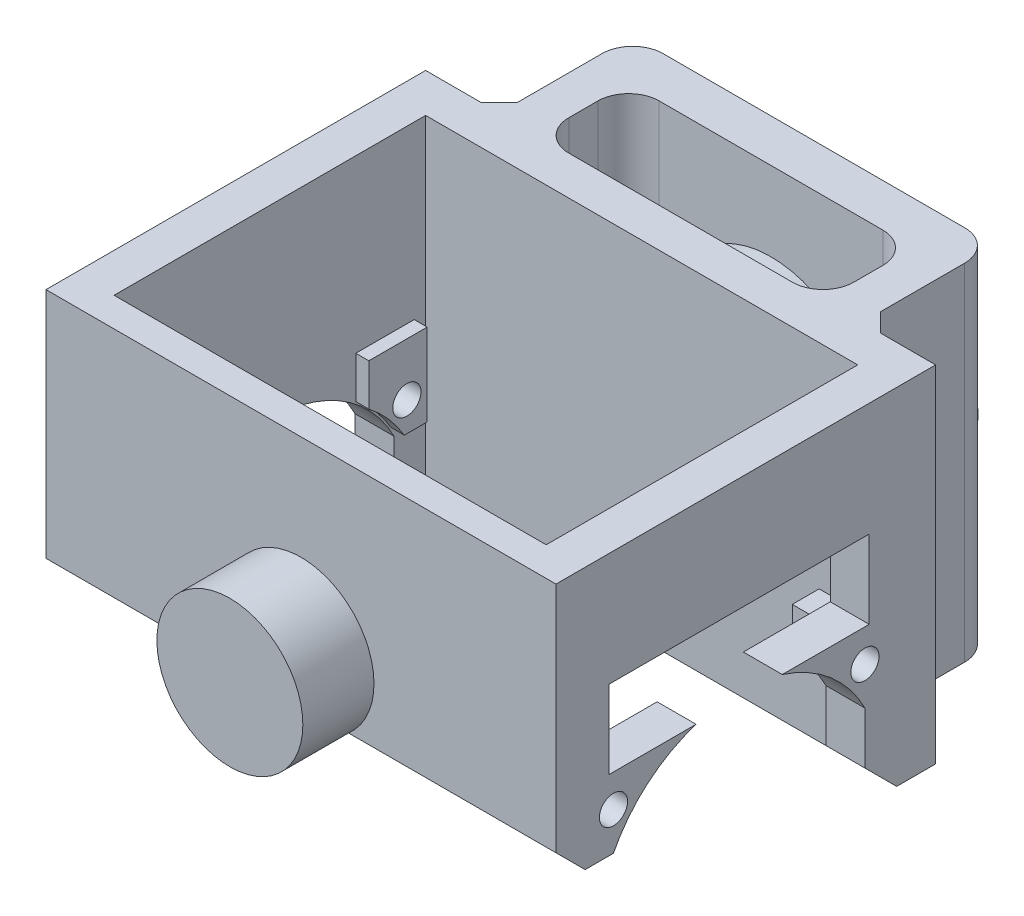
from build123d import *
from build123d.topology import SkipClean

# Parameters (mm, degrees)
SKETCH1_W                       = 25
SKETCH1_H                       = 30
BOSS_EXTRUDE1_DEPTH             = 3.175
SKETCH2_W                       = 25
SKETCH2_H                       = 3.175
BOSS_EXTRUDE2_DEPTH             = 41.58
SKETCH3_W                       = 3.175
SKETCH3_H                       = 25
BOSS_EXTRUDE3_DEPTH             = 30
CUT_EXTRUDE1_REACH              = 60.775
SKETCH4_R                       = 11.5
CUT_EXTRUDE2_REACH              = 60.775
SKETCH5_R                       = 0.8
SKETCH5_R_2                     = 1.15
CUT_EXTRUDE3_REACH              = 60.775
SKETCH6_R                       = 0.799851166
SKETCH6_R_2                     = 0.8
SKETCH6_R_3                     = 1.15
SKETCH6_W                       = 21.2
SKETCH6_H                       = 6.375
CUT_EXTRUDE4_REACH              = 60.775
SKETCH7_R                       = 11.5
BOSS_EXTRUDE4_DEPTH             = 0.2
SKETCH9_W                       = 41.58
SKETCH9_H                       = 33.175
BOSS_EXTRUDE5_DEPTH             = 3.175
BOSS_EXTRUDE6_DEPTH             = 0.2
SKETCH11_W                      = 41.58
SKETCH11_H                      = 33.175
BOSS_EXTRUDE7_DEPTH             = 3.175
CHAMFER1_SIZE                   = 3.175
CHAMFER2_SIZE                   = 3.175
SKETCH13_W                      = 29.58
SKETCH13_H                      = 3.175
BOSS_EXTRUDE8_DEPTH             = 7.695
BOSS_EXTRUDE9_REACH             = 59.968
SKETCH14_W                      = 29.58
SKETCH14_H                      = 3.5
BOSS_EXTRUDE9_DIRECTION_2_DEPTH = 25
FILLET2_R                       = 1.5875
CUT_EXTRUDE5_REACH              = 70.161
SKETCH16_R                      = 7.1
SKETCH20_R                      = 8
SKETCH20_R_2                    = 4.1
BOSS_EXTRUDE11_DEPTH            = 5
BOSS_EXTRUDE12_DEPTH            = 5
BOSS_EXTRUDE12_DEPTH_BACK       = 1.2
SKETCH23_R                      = 5.95
SKETCH23_R_2                    = 4.1
CUT_EXTRUDE9_START              = -0.8
SKETCH35_W                      = 56.674577384
SKETCH35_H                      = 32.233153273
SKETCH35_R                      = 5.95
CUT_EXTRUDE9_DEPTH              = 0.8
CHAMFER4_SIZE                   = 1.5
SKETCH24_R                      = 11.575
SKETCH24_R_2                    = 10.075
BOSS_EXTRUDE13_DEPTH            = 1.8
SKETCH25_W                      = 108.105246784
SKETCH25_H                      = 63.591321638
CUT_EXTRUDE7_DEPTH              = 11.825
CUT_EXTRUDE8_START              = -3.175
SKETCH26_R                      = 4.1
CUT_EXTRUDE8_DEPTH              = 3.175
BOSS_EXTRUDE14_START            = 1.975
BOSS_EXTRUDE14_DEPTH            = 1.975
BOSS_EXTRUDE16_START            = 3.5
SKETCH29_R                      = 7.1
SKETCH29_R_2                    = 4.1
BOSS_EXTRUDE16_DEPTH            = 3.5
BOSS_EXTRUDE17_REACH            = 66.275
SKETCH31_W                      = 3.175
SKETCH31_H                      = 26.839044126
BOSS_EXTRUDE18_DEPTH            = 6.825
SKETCH34_R                      = 8
SKETCH34_R_2                    = 4.1
BOSS_EXTRUDE19_DEPTH            = 2.37
CUT_EXTRUDE6_REACH              = 66.865
SKETCH21_R                      = 1.9
CHAMFER7_SIZE                   = 3.175
SKETCH36_R                      = 7.5
CUT_EXTRUDE10_DEPTH             = 0.4
BOSS_EXTRUDE20_START            = -8.175
SKETCH37_R                      = 4.1
BOSS_EXTRUDE20_DEPTH            = 8.175
SKETCH39_R                      = 1.15
BOSS_EXTRUDE22_DEPTH            = 1.87
BOSS_EXTRUDE23_DEPTH            = 1.06
CUT_EXTRUDE11_START             = -3.175
CUT_EXTRUDE11_OUTLINE_W         = 23.23
CUT_EXTRUDE11_OUTLINE_H         = 7.37
CUT_EXTRUDE11_DEPTH             = 4.675
FILLET3_R                       = 2.5
FILLET4_R                       = 2.5
SKETCH42_W                      = 3.501413345
SKETCH42_H                      = 2.461352655
SKETCH42_W_2                    = 5.24981121
SKETCH42_H_2                    = 2.530526346
CUT_EXTRUDE12_DEPTH             = 63.204589294
CUT_EXTRUDE13_DEPTH             = 61.128683291
CUT_EXTRUDE13_DEPTH_BACK        = 61.128683291
SKETCH44_R                      = 1.15
CUT_EXTRUDE14_DEPTH             = 10


# Read off the part's stored shape, not the designer's step: Cut-Extrude11
# Some blends are built 0.0001 mm under size
with BuildPart() as part:
    # Sketch1 → Boss-Extrude1 (new body)
    with BuildSketch(Plane(origin=(0, 0, 0), x_dir=(0, 0, -1), z_dir=(1, 0, 0))):
        with Locations((12.5, 15)):
            Rectangle(SKETCH1_W, SKETCH1_H)
    extrude(amount=BOSS_EXTRUDE1_DEPTH)

    # Sketch2 → Boss-Extrude2 (add)
    with BuildSketch(Plane.ZY):
        with Locations((-12.5, 31.5875)):
            Rectangle(SKETCH2_W, SKETCH2_H)
    extrude(amount=-BOSS_EXTRUDE2_DEPTH)

    # Sketch3 → Boss-Extrude3 (add)
    with BuildSketch(Plane.XZ.offset(-30)):
        with Locations((39.9925, -12.5)):
            Rectangle(SKETCH3_W, SKETCH3_H)
    extrude(amount=BOSS_EXTRUDE3_DEPTH)

    # Sketch4 → Cut-Extrude1 (cut, up to next)
    with BuildSketch(Plane.ZY, mode=Mode.PRIVATE) as cut_extrude1_sk1:
        with Locations((-12.359999929, -5.209996254)):
            Circle(SKETCH4_R)
    cut_extrude1_tool1 = extrude(cut_extrude1_sk1.sketch, amount=-CUT_EXTRUDE1_REACH, mode=Mode.PRIVATE) & part.part
    add(cut_extrude1_tool1.solids().sort_by_distance((0, -5.209996, -12.36))[0], mode=Mode.SUBTRACT)

    # Sketch5 → Cut-Extrude2 (cut, up to next)
    with BuildSketch(Plane.ZY, mode=Mode.PRIVATE) as cut_extrude2_sk1:
        with Locations((-22.609999929, 23.790003746)):
            Circle(SKETCH5_R)
    cut_extrude2_tool1 = extrude(cut_extrude2_sk1.sketch, amount=-CUT_EXTRUDE2_REACH, mode=Mode.PRIVATE) & part.part
    # Sketch5 → Cut-Extrude2 (cut, up to next)
    with BuildSketch(Plane.ZY, mode=Mode.PRIVATE) as cut_extrude2_sk2:
        with Locations((-2.109999929, 23.790003746)):
            Circle(SKETCH5_R)
    cut_extrude2_tool2 = extrude(cut_extrude2_sk2.sketch, amount=-CUT_EXTRUDE2_REACH, mode=Mode.PRIVATE) & part.part
    # Sketch5 → Cut-Extrude2 (cut, up to next)
    with BuildSketch(Plane.ZY, mode=Mode.PRIVATE) as cut_extrude2_sk3:
        with Locations((-22.609999929, 3.090003746)):
            Circle(SKETCH5_R_2)
    cut_extrude2_tool3 = extrude(cut_extrude2_sk3.sketch, amount=-CUT_EXTRUDE2_REACH, mode=Mode.PRIVATE) & part.part
    # Sketch5 → Cut-Extrude2 (cut, up to next)
    with BuildSketch(Plane.ZY, mode=Mode.PRIVATE) as cut_extrude2_sk4:
        with Locations((-2.109999929, 3.090003746)):
            Circle(SKETCH5_R_2)
    cut_extrude2_tool4 = extrude(cut_extrude2_sk4.sketch, amount=-CUT_EXTRUDE2_REACH, mode=Mode.PRIVATE) & part.part
    add(cut_extrude2_tool1.solids().sort_by_distance((0, 23.790004, -22.61))[0], mode=Mode.SUBTRACT)
    add(cut_extrude2_tool2.solids().sort_by_distance((0, 23.790004, -2.11))[0], mode=Mode.SUBTRACT)
    add(cut_extrude2_tool3.solids().sort_by_distance((0, 3.090004, -22.61))[0], mode=Mode.SUBTRACT)
    add(cut_extrude2_tool4.solids().sort_by_distance((0, 3.090004, -2.11))[0], mode=Mode.SUBTRACT)

    # Sketch6 → Cut-Extrude3 (cut, up to next)
    with BuildSketch(Plane(origin=(41.58, 0, 0), x_dir=(0, 0, -1), z_dir=(1, 0, 0)), mode=Mode.PRIVATE) as cut_extrude3_sk1:
        with Locations((22.609999929, 27.540003746)):
            Circle(SKETCH6_R)
    cut_extrude3_tool1 = extrude(cut_extrude3_sk1.sketch, amount=-CUT_EXTRUDE3_REACH, mode=Mode.PRIVATE) & part.part
    # Sketch6 → Cut-Extrude3 (cut, up to next)
    with BuildSketch(Plane(origin=(41.58, 0, 0), x_dir=(0, 0, -1), z_dir=(1, 0, 0)), mode=Mode.PRIVATE) as cut_extrude3_sk2:
        with Locations((2.109999929, 27.540003746)):
            Circle(SKETCH6_R_2)
    cut_extrude3_tool2 = extrude(cut_extrude3_sk2.sketch, amount=-CUT_EXTRUDE3_REACH, mode=Mode.PRIVATE) & part.part
    # Sketch6 → Cut-Extrude3 (cut, up to next)
    with BuildSketch(Plane(origin=(41.58, 0, 0), x_dir=(0, 0, -1), z_dir=(1, 0, 0)), mode=Mode.PRIVATE) as cut_extrude3_sk3:
        with Locations(Location((2.109999929, 3.090003746, 0), (0, 0, 180))):
            Circle(SKETCH6_R_3)
    cut_extrude3_tool3 = extrude(cut_extrude3_sk3.sketch, amount=-CUT_EXTRUDE3_REACH, mode=Mode.PRIVATE) & part.part
    # Sketch6 → Cut-Extrude3 (cut, up to next)
    with BuildSketch(Plane(origin=(41.58, 0, 0), x_dir=(0, 0, -1), z_dir=(1, 0, 0)), mode=Mode.PRIVATE) as cut_extrude3_sk4:
        with Locations(Location((22.609999929, 3.090003746, 0), (0, 0, 180))):
            Circle(SKETCH6_R_3)
    cut_extrude3_tool4 = extrude(cut_extrude3_sk4.sketch, amount=-CUT_EXTRUDE3_REACH, mode=Mode.PRIVATE) & part.part
    # Sketch6 → Cut-Extrude3 (cut, up to next)
    with BuildSketch(Plane(origin=(41.58, 0, 0), x_dir=(0, 0, -1), z_dir=(1, 0, 0)), mode=Mode.PRIVATE) as cut_extrude3_sk5:
        with Locations((12.359999929, 8.927503746)):
            Rectangle(SKETCH6_W, SKETCH6_H)
    cut_extrude3_tool5 = extrude(cut_extrude3_sk5.sketch, amount=-CUT_EXTRUDE3_REACH, mode=Mode.PRIVATE) & part.part
    add(cut_extrude3_tool1.solids().sort_by_distance((41.58, 27.540004, -22.61))[0], mode=Mode.SUBTRACT)
    add(cut_extrude3_tool2.solids().sort_by_distance((41.58, 27.540004, -2.11))[0], mode=Mode.SUBTRACT)
    add(cut_extrude3_tool3.solids().sort_by_distance((41.58, 3.090004, -2.11))[0], mode=Mode.SUBTRACT)
    add(cut_extrude3_tool4.solids().sort_by_distance((41.58, 3.090004, -22.61))[0], mode=Mode.SUBTRACT)
    add(cut_extrude3_tool5.solids().sort_by_distance((41.58, 8.927504, -12.36))[0], mode=Mode.SUBTRACT)

    # Sketch7 → Cut-Extrude4 (cut, up to next)
    with BuildSketch(Plane(origin=(41.58, 0, 0), x_dir=(0, 0, -1), z_dir=(1, 0, 0)), mode=Mode.PRIVATE) as cut_extrude4_sk1:
        with Locations((12.359999929, -5.209996254)):
            Circle(SKETCH7_R)
    cut_extrude4_tool1 = extrude(cut_extrude4_sk1.sketch, amount=-CUT_EXTRUDE4_REACH, mode=Mode.PRIVATE) & part.part
    add(cut_extrude4_tool1.solids().sort_by_distance((41.58, -5.209996, -12.36))[0], mode=Mode.SUBTRACT)

    # Sketch8 → Boss-Extrude4 (add)
    with BuildSketch(Plane.XY):
        Polygon((0, 33.175), (0, 0), (3.175, 0), (3.175, 30), (38.405, 30), (38.405, 0), (41.58, 0), (41.58, 33.175), align=None)
    extrude(amount=BOSS_EXTRUDE4_DEPTH)

    # Sketch9 → Boss-Extrude5 (add)
    with BuildSketch(Plane.XY.offset(0.2)):
        with Locations((20.79, 16.5875)):
            Rectangle(SKETCH9_W, SKETCH9_H)
    extrude(amount=BOSS_EXTRUDE5_DEPTH)

    # Sketch10 → Boss-Extrude6 (add)
    with BuildSketch(Plane(origin=(0, 0, -25), x_dir=(-1, 0, 0), z_dir=(0, 0, -1))):
        Polygon((0, 0), (0, 33.175), (-41.58, 33.175), (-41.58, 0), (-38.405, 0), (-38.405, 30), (-3.175, 30), (-3.175, 0), align=None)
    extrude(amount=BOSS_EXTRUDE6_DEPTH)

    # Sketch11 → Boss-Extrude7 (add)
    with BuildSketch(Plane(origin=(0, 0, -25.2), x_dir=(-1, 0, 0), z_dir=(0, 0, -1))):
        with Locations((-20.79, 16.5875)):
            Rectangle(SKETCH11_W, SKETCH11_H)
    extrude(amount=BOSS_EXTRUDE7_DEPTH)

    # Chamfer1
    chamfer1_edges = [part.edges().sort_by_distance(p)[0] for p in [
        (20.79, 33.175, 3.375),
        (20.79, 33.175, -28.375),
    ]]
    chamfer(chamfer1_edges, length=CHAMFER1_SIZE)

    # Chamfer2
    chamfer2_edges = [part.edges().sort_by_distance(p)[0] for p in [
        (20.79, 0, 3.375),
    ]]
    chamfer(chamfer2_edges, length=CHAMFER2_SIZE - 0.0001)  # a hair under: the kernel refuses the full size

    # Sketch13 → Boss-Extrude8 (add)
    with BuildSketch(Plane(origin=(0, 0, -28.375), x_dir=(-1, 0, 0), z_dir=(0, 0, -1))):
        with Locations((-20.79, 19.7625)):
            Rectangle(SKETCH13_W, SKETCH13_H)
    extrude(amount=BOSS_EXTRUDE8_DEPTH)

    # Boss-Extrude9: up to this face of the body (flat: up to its plane)
    boss_extrude9_end = Plane(part.part.faces().sort_by_distance((20.79, 21.35, -32.2225))[0])
    # Sketch14 → Boss-Extrude9 (add, up to the picked face)
    with BuildSketch(Plane.XZ.offset(-18.175), mode=Mode.PRIVATE) as boss_extrude9_sk1:
        with Locations((20.79, -37.495)):
            Rectangle(SKETCH14_W, SKETCH14_H)
    boss_extrude9_tool1 = split(extrude(boss_extrude9_sk1.sketch, amount=-BOSS_EXTRUDE9_REACH, mode=Mode.PRIVATE), bisect_by=boss_extrude9_end, keep=Keep.BOTH, mode=Mode.PRIVATE)
    add(boss_extrude9_tool1.solids().sort_by(Axis((20.79, 18.175, -37.495), (0, 1, 0)))[0])

    # Sketch14 → Boss-Extrude9 direction 2 (add)
    with BuildSketch(Plane.XZ.offset(-18.175)):
        with Locations((20.79, -37.495)):
            Rectangle(SKETCH14_W, SKETCH14_H)
    extrude(amount=BOSS_EXTRUDE9_DIRECTION_2_DEPTH)

    # Fillet2
    fillet2_edges = [part.edges().sort_by_distance(p)[0] for p in [
        (20.79, 21.35, -28.375),
    ]]
    fillet(fillet2_edges, radius=FILLET2_R)

    # Sketch16 → Cut-Extrude5 (cut, up to next)
    with BuildSketch(Plane(origin=(0, 0, -39.245), x_dir=(-1, 0, 0), z_dir=(0, 0, -1)), mode=Mode.PRIVATE) as cut_extrude5_sk1:
        with Locations((-20.79, 6.9025)):
            Circle(SKETCH16_R)
    cut_extrude5_tool1 = extrude(cut_extrude5_sk1.sketch, amount=-CUT_EXTRUDE5_REACH, mode=Mode.PRIVATE) & part.part
    add(cut_extrude5_tool1.solids().sort_by_distance((20.79, 6.9025, -39.245))[0], mode=Mode.SUBTRACT)

    # Sketch20 → Boss-Extrude11 (add)
    with BuildSketch(Plane.XY.offset(-35.745)):
        with Locations(Location((20.79, 6.9025, 0), (0, 0, 180))):
            Circle(SKETCH20_R)
        with Locations((20.79, 6.9025)):
            Circle(SKETCH20_R_2, mode=Mode.SUBTRACT)
    extrude(amount=BOSS_EXTRUDE11_DEPTH)

    # Sketch23 → Boss-Extrude12 (add, two sides: drawn at the far end of the back side and taken through both)
    with BuildSketch(Plane.XY.offset(3.375).offset(-BOSS_EXTRUDE12_DEPTH_BACK)):
        with Locations(Location((20.79, 6.9025, 0), (0, 0, 218.790206305))):
            Circle(SKETCH23_R)
        with Locations((20.79, 6.9025)):
            Circle(SKETCH23_R_2, mode=Mode.SUBTRACT)
    extrude(amount=BOSS_EXTRUDE12_DEPTH + BOSS_EXTRUDE12_DEPTH_BACK)

    # Sketch35 → Cut-Extrude9 (cut)
    with BuildSketch(Plane.XY.offset(3.375).offset(CUT_EXTRUDE9_START)):
        with Locations((23.209536951, 5.991217874)):
            Rectangle(SKETCH35_W, SKETCH35_H)
        with Locations(Location((20.79, 6.9025, 0), (0, 0, 229.545756186))):
            Circle(SKETCH35_R, mode=Mode.SUBTRACT)
    extrude(amount=CUT_EXTRUDE9_DEPTH, mode=Mode.SUBTRACT)

    # Chamfer4
    chamfer4_edges = [part.edges().sort_by_distance(p)[0] for p in [
        (35.58, 20.55625, -28.375),
        (20.79, 18.175, -28.375),
        (6, 20.55625, -28.375),
    ]]
    chamfer(chamfer4_edges, length=CHAMFER4_SIZE)

    # Sketch24 → Boss-Extrude13 (add)
    with BuildSketch(Plane(origin=(0, 0, -39.245), x_dir=(-1, 0, 0), z_dir=(0, 0, -1))):
        with Locations((-20.79, 6.9025)):
            Circle(SKETCH24_R)
        with Locations((-20.79, 6.9025)):
            Circle(SKETCH24_R_2, mode=Mode.SUBTRACT)
    extrude(amount=BOSS_EXTRUDE13_DEPTH)

    # Sketch25 → Cut-Extrude7 (cut)
    with BuildSketch(Plane(origin=(0, 33.175, 0), x_dir=(1, 0, 0), z_dir=(0, 1, 0))):
        with Locations((27.427563227, 10.078434484)):
            Rectangle(SKETCH25_W, SKETCH25_H)
    extrude(amount=-CUT_EXTRUDE7_DEPTH, mode=Mode.SUBTRACT)

    # Sketch26 → Cut-Extrude8 (cut)
    with BuildSketch(Plane.XY.offset(3.375).offset(CUT_EXTRUDE8_START)):
        with Locations((20.79, 6.9025)):
            Circle(SKETCH26_R)
    extrude(amount=CUT_EXTRUDE8_DEPTH, mode=Mode.SUBTRACT)

    # Sketch27 → Boss-Extrude14 (add)
    with SkipClean():  # the faces are left unmerged after this step: merging them gives an invalid solid
        with BuildSketch(Plane(origin=(0, 0, 2.175), x_dir=(-1, 0, 0), z_dir=(0, 0, -1)).offset(BOSS_EXTRUDE14_START)):
            with BuildLine():
                Line((-17.454997189, 1.975), (-24.125002811, 1.975))
                ThreePointArc((-24.125002811, 1.975), (-20.79, 0.9525), (-17.454997189, 1.975))
            make_face()
        extrude(amount=-BOSS_EXTRUDE14_DEPTH)

    # Sketch29 → Boss-Extrude16 (add)
    with SkipClean():  # the faces are left unmerged after this step: merging them gives an invalid solid
        with BuildSketch(Plane(origin=(0, 0, -35.745), x_dir=(-1, 0, 0), z_dir=(0, 0, -1)).offset(BOSS_EXTRUDE16_START)):
            with Locations((-20.79, 6.9025)):
                Circle(SKETCH29_R)
            with Locations(Location((-20.79, 6.9025, 0), (0, 0, 180))):
                Circle(SKETCH29_R_2, mode=Mode.SUBTRACT)
        extrude(amount=-BOSS_EXTRUDE16_DEPTH)

    # Boss-Extrude17: up to this face of the body (flat: up to its plane)
    boss_extrude17_end = Plane(part.part.faces().sort_by_distance((20.79, 8.948239046, -28.375))[0])
    # Sketch31 → Boss-Extrude17 (add, up to the picked face)
    with BuildSketch(Plane.XY.offset(-35.745), mode=Mode.PRIVATE) as boss_extrude17_sk1:
        with Locations((7.5875, 6.594522063)):
            Rectangle(SKETCH31_W, SKETCH31_H)
    boss_extrude17_tool1 = split(extrude(boss_extrude17_sk1.sketch, amount=BOSS_EXTRUDE17_REACH, mode=Mode.PRIVATE), bisect_by=boss_extrude17_end, keep=Keep.BOTH, mode=Mode.PRIVATE)
    # Sketch31 → Boss-Extrude17 (add, up to the picked face)
    with BuildSketch(Plane.XY.offset(-35.745), mode=Mode.PRIVATE) as boss_extrude17_sk2:
        with Locations((33.9925, 6.594522063)):
            Rectangle(SKETCH31_W, SKETCH31_H)
    boss_extrude17_tool2 = split(extrude(boss_extrude17_sk2.sketch, amount=BOSS_EXTRUDE17_REACH, mode=Mode.PRIVATE), bisect_by=boss_extrude17_end, keep=Keep.BOTH, mode=Mode.PRIVATE)
    add(boss_extrude17_tool1.solids().sort_by(Axis((7.5875, 6.594522, -35.745), (0, 0, 1)))[0])
    add(boss_extrude17_tool2.solids().sort_by(Axis((33.9925, 6.594522, -35.745), (0, 0, 1)))[0])

    # Sketch33 → Boss-Extrude18 (add)
    with SkipClean():  # the faces are left unmerged after this step: merging them gives an invalid solid
        with BuildSketch(Plane.XZ):
            Polygon((3.175, -25.2), (3.175, -22.612118687), (0, -22.612118687), (0, -28.375), (6, -28.375), (9.175, -28.375), (32.405, -28.375), (35.58, -28.375), (41.58, -28.375), (41.58, -22.612118687), (38.405, -22.612118687), (38.405, -25.2), align=None)
        extrude(amount=BOSS_EXTRUDE18_DEPTH)

    # Sketch34 → Boss-Extrude19 (add)
    with SkipClean():  # the faces are left unmerged after this step: merging them gives an invalid solid
        with BuildSketch(Plane.XY.offset(-30.745)):
            with Locations(Location((20.79, 6.9025, 0), (0, 0, 180))):
                Circle(SKETCH34_R)
            with Locations((20.79, 6.9025)):
                Circle(SKETCH34_R_2, mode=Mode.SUBTRACT)
        extrude(amount=BOSS_EXTRUDE19_DEPTH)

    # Cut-Extrude6: up to this face of the body (flat: up to its plane)
    cut_extrude6_end = Plane(part.part.faces().sort_by_distance((20.79, 18.175, -32.81))[0])
    # Sketch21 → Cut-Extrude6 (cut, up to the picked face)
    with BuildSketch(Plane.XZ.offset(6.825), mode=Mode.PRIVATE) as cut_extrude6_sk1:
        with Locations(Location((20.79, -32.06, 0), (0, 0, 270))):
            Circle(SKETCH21_R)
    cut_extrude6_tool1 = split(extrude(cut_extrude6_sk1.sketch, amount=-CUT_EXTRUDE6_REACH, mode=Mode.PRIVATE), bisect_by=cut_extrude6_end, keep=Keep.BOTH, mode=Mode.PRIVATE)
    add(cut_extrude6_tool1.solids().sort_by(Axis((20.79, -6.825, -32.06), (0, 1, 0)))[0], mode=Mode.SUBTRACT)

    # Chamfer7
    # the kernel refuses this chamfer: 3.175 mm, written as the material it takes off along each edge
    with BuildSketch(Plane(origin=(32.405, -6.825, -35.745), x_dir=(0, -0.02749587661058651, -0.9996219169112966), z_dir=(-1, 0, 0))) as chamfer7_piece_1:
        Polygon((CHAMFER7_SIZE * 0.999621916911, -CHAMFER7_SIZE * 0.0274958766106), (-CHAMFER7_SIZE * 0.0274958766106, -CHAMFER7_SIZE * 0.999621916911), (0, 0), align=None)
    extrude(amount=23.23, mode=Mode.SUBTRACT)
    with BuildSketch(Plane(origin=(32.405, -6.825, -28.375), x_dir=(0, -0.027495876610586455, 0.9996219169112968), z_dir=(-1, 0, 0))) as chamfer7_piece_2:
        Polygon((CHAMFER7_SIZE * 0.999621916911, CHAMFER7_SIZE * 0.0274958766106), (-CHAMFER7_SIZE * 0.0274958766106, CHAMFER7_SIZE * 0.999621916911), (0, 0), align=None)
    extrude(amount=23.23, mode=Mode.SUBTRACT)

    # Sketch36 → Cut-Extrude10 (cut)
    with BuildSketch(Plane(origin=(0, 0, -39.245), x_dir=(-1, 0, 0), z_dir=(0, 0, -1))):
        with Locations((-20.79, 6.9025)):
            Circle(SKETCH36_R)
    extrude(amount=-CUT_EXTRUDE10_DEPTH, mode=Mode.SUBTRACT)

    # Sketch37 → Boss-Extrude20 (add)
    with BuildSketch(Plane.XY.offset(8.375).offset(BOSS_EXTRUDE20_START)):
        with Locations(Location((20.79, 6.9025, 0), (0, 0, 180))):
            Circle(SKETCH37_R)
    extrude(amount=BOSS_EXTRUDE20_DEPTH)

    # Sketch39 → Boss-Extrude22 (add)
    # profile 1 of 2: a face of its own
    with BuildSketch(Plane.ZY.offset(-38.405)):
        with BuildLine():
            Line((-0.799999454, 5.240003755), (-1.259999929, 5.240003755))
            Line((-1.259999929, 5.240003755), (-5.060001007, 5.240003683))
            Line((-5.060001007, 5.240003683), (-5.060003358, 3.921799067))
            ThreePointArc((-5.060003358, 3.921799067), (-3.654457689, 2.593411337), (-2.487135002, 1.051487106))
            Line((-2.487135002, 1.051487106), (-1.000011391, 1.051488714))
            ThreePointArc((-1.000011391, 1.051488714), (-0.858544049, 1.11010249), (-0.80000455, 1.251600584))
            Line((-0.80000455, 1.251600584), (-0.799999454, 5.240003755))
        make_face()
        with Locations((-2.109999929, 3.090003746)):
            Circle(SKETCH39_R, mode=Mode.SUBTRACT)
    # profile 2 of 2: a face of its own
    with BuildSketch(Plane.ZY.offset(-38.405)):
        with BuildLine():
            Line((-23.459999929, 5.240003755), (-23.920005797, 5.240003755))
            Line((-23.920005797, 5.240003755), (-23.92000108, 1.251499539))
            ThreePointArc((-23.92000108, 1.251499539), (-23.861425337, 1.110068331), (-23.719996811, 1.051486113))
            Line((-23.719996811, 1.051486113), (-22.232868888, 1.051484514))
            ThreePointArc((-22.232868888, 1.051484514), (-21.065544591, 2.593411657), (-19.659996515, 3.921801637))
            Line((-19.659996515, 3.921801637), (-19.659998855, 5.240003683))
            Line((-19.659998855, 5.240003683), (-23.459999929, 5.240003755))
        make_face()
        with Locations((-22.609999929, 3.090003746)):
            Circle(SKETCH39_R, mode=Mode.SUBTRACT)
    extrude(amount=BOSS_EXTRUDE22_DEPTH)

    # Sketch40 → Boss-Extrude23 (add)
    with BuildSketch(Plane(origin=(3.175, 0, 0), x_dir=(0, 0, -1), z_dir=(1, 0, 0))):
        with BuildLine():
            Line((24.266293531, 0.751531013), (24.266296254, 7.400923006))
            Line((24.266296254, 7.400923006), (19.509999928, 7.400923006))
            Line((19.509999928, 7.400923006), (19.509999929, 3.988188515))
            ThreePointArc((19.509999929, 3.988188515), (21.100871305, 2.49235974), (22.384610234, 0.725897674))
            add(Edge.make_bspline(
                [(22.384610234, 0.725897674), (22.387791043, 0.720646445), (22.392287005, 0.716127465), (22.397220358, 0.712473019), (22.402496012, 0.70856501), (22.408511961, 0.705489663), (22.414791694, 0.703573937), (22.418839437, 0.702339113), (22.423083651, 0.701558228), (22.427314984, 0.70148867)],
                knots=[0, 0, 0, 0, 1.8418e-05, 1.8418e-05, 1.8418e-05, 3.8078e-05, 3.8078e-05, 3.8078e-05, 5.067e-05, 5.067e-05, 5.067e-05, 5.067e-05], degree=3))
            Line((22.427314984, 0.70148867), (24.216289389, 0.70148994))
            ThreePointArc((24.216289389, 0.70148994), (24.251665822, 0.716145176), (24.266293531, 0.751531013))
        make_face()
        with BuildLine():
            Line((5.209999929, 3.988158051), (5.209999929, 7.400923006))
            Line((5.209999929, 7.400923006), (0.453779662, 7.400923006))
            Line((0.453779662, 7.400923006), (0.45378068, 0.751499976))
            ThreePointArc((0.45378068, 0.751499976), (0.468421132, 0.716137146), (0.503781069, 0.701489843))
            Line((0.503781069, 0.701489843), (2.292521705, 0.701488663))
            add(Edge.make_bspline(
                [(2.292521705, 0.701488663), (2.298521801, 0.701494614), (2.304572892, 0.702969207), (2.310126848, 0.705239618), (2.316136217, 0.707696198), (2.321819239, 0.711208493), (2.326659601, 0.715534946), (2.329870247, 0.718404712), (2.332785477, 0.721696578), (2.33504504, 0.725362391)],
                knots=[0, 0, 0, 0, 1.8e-05, 1.8e-05, 1.8e-05, 3.7444e-05, 3.7444e-05, 3.7444e-05, 5.0267e-05, 5.0267e-05, 5.0267e-05, 5.0267e-05], degree=3))
            ThreePointArc((2.33504504, 0.725362391), (3.61893481, 2.492091293), (5.209999929, 3.988158051))
        make_face()
    extrude(amount=BOSS_EXTRUDE23_DEPTH)

    # Cut-Extrude11 outline → Cut-Extrude11 (cut)
    with BuildSketch(Plane.XZ.offset(-18.175).offset(CUT_EXTRUDE11_START)):
        with Locations((20.79, -32.06)):
            Rectangle(CUT_EXTRUDE11_OUTLINE_W, CUT_EXTRUDE11_OUTLINE_H)
    extrude(amount=CUT_EXTRUDE11_DEPTH, mode=Mode.SUBTRACT)

    # Fillet3
    fillet3_edges = [part.edges().sort_by_distance(p)[0] for p in [
        (9.175, 8.85, -35.745),
        (9.175, 8.85, -28.375),
        (32.405, 8.85, -35.745),
        (32.405, 8.85, -28.375),
    ]]
    fillet(fillet3_edges, radius=FILLET3_R)

    # Fillet4
    fillet4_edges = [part.edges().sort_by_distance(p)[0] for p in [
        (35.58, 7.2625, -39.245),
        (6, 7.2625, -39.245),
    ]]
    fillet(fillet4_edges, radius=FILLET4_R)

    # Sketch42 → Cut-Extrude12 (cut, through all)
    with BuildSketch(Plane.XZ):
        with Locations((36.654293327, -4.217811329)):
            Rectangle(SKETCH42_W, SKETCH42_H)
        with Locations((35.780094395, -20.467605715)):
            Rectangle(SKETCH42_W_2, SKETCH42_H_2)
    extrude(amount=-CUT_EXTRUDE12_DEPTH, mode=Mode.SUBTRACT)

    # Sketch43 → Cut-Extrude13 (cut, two sides: drawn at the far end of the back side and taken through both)
    with BuildSketch(Plane.ZY.offset(-38.405).offset(-CUT_EXTRUDE13_DEPTH_BACK)):
        Polygon((-25.2, -6.825), (-22.612118687, -4.237118687), (-22.612118687, -6.825), align=None)
    extrude(amount=CUT_EXTRUDE13_DEPTH + CUT_EXTRUDE13_DEPTH_BACK, mode=Mode.SUBTRACT)

    # Sketch44 → Cut-Extrude14 (cut)
    with BuildSketch(Plane.ZY.offset(-3.175)):
        with Locations((-22.609999929, 3.090003746)):
            Circle(SKETCH44_R)
        with Locations((-2.109999929, 3.090003746)):
            Circle(SKETCH44_R)
    extrude(amount=-CUT_EXTRUDE14_DEPTH, mode=Mode.SUBTRACT)


solid = part.part
